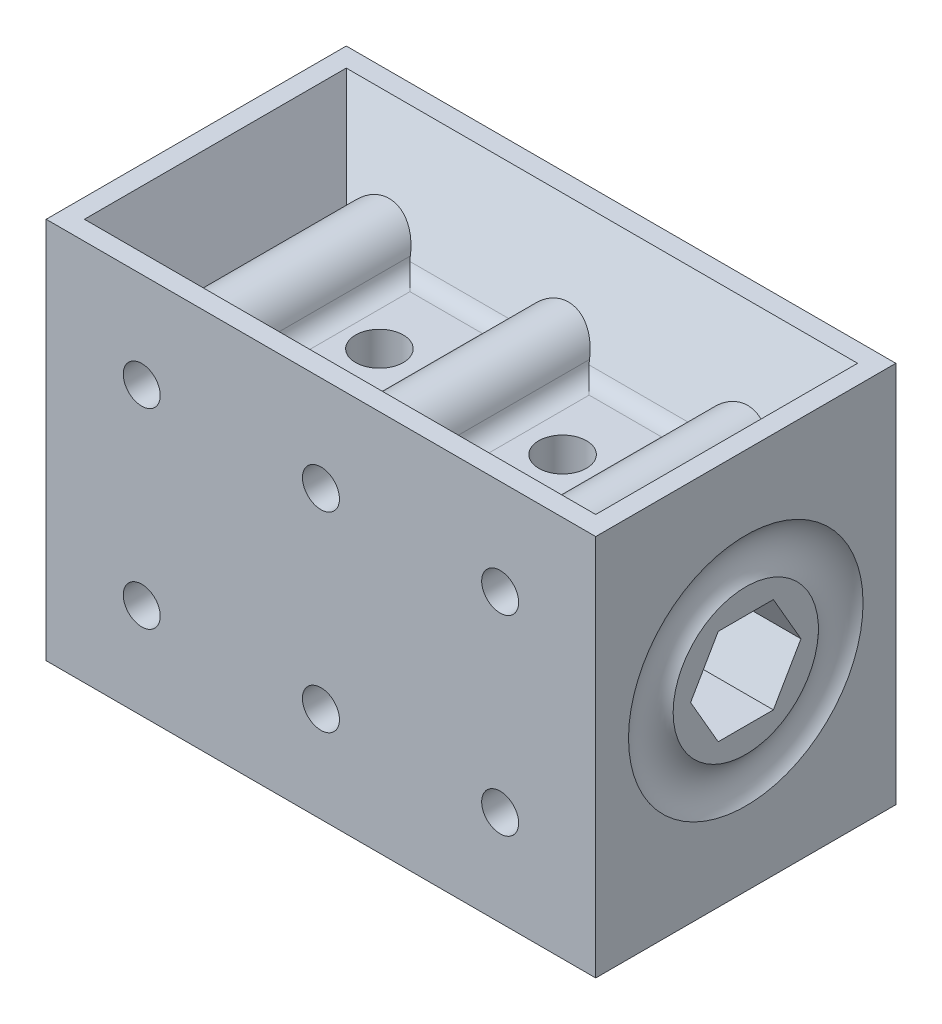
from build123d import *

# Parameters (mm, degrees)
SKETCH1_W                    = 39.878
SKETCH1_H                    = 50.8
BOSS_EXTRUDE1_DEPTH          = 73.025
CUT_EXTRUDE2_DEPTH           = 80.845941325
SKETCH9_R                    = 3.175
CUT_EXTRUDE4_DEPTH           = 93.511894506
F_10_0_1935_DIAMETER_HOLE1_D = 4.9149
SKETCH11_W                   = 67.945
SKETCH11_H                   = 34.798
CUT_EXTRUDE5_DEPTH           = 12.7
CUT_EXTRUDE5_DRAFT           = -30
EXTRUDE_THIN1_REACH          = 88.995
SKETCH12_R                   = 4.99745
SKETCH12_R_2                 = 2.45745
FILLET1_R                    = 2.54


with BuildPart() as part:
    # Sketch1 → Boss-Extrude1 (new body)
    with BuildSketch(Plane(origin=(0, 0, 0), x_dir=(0, 0, -1), z_dir=(1, 0, 0))):
        Rectangle(SKETCH1_W, SKETCH1_H)
    extrude(amount=BOSS_EXTRUDE1_DEPTH)

    # Sketch3 → Cut-Extrude2 (cut, through all)
    with BuildSketch(Plane(origin=(73.025, 0, 0), x_dir=(0, 0, -1), z_dir=(1, 0, 0))):
        Polygon((3.666174209, 6.35), (-3.666174209, 6.35), (-7.332348419, 0), (-3.666174209, -6.35), (3.666174209, -6.35), (7.332348419, 0), align=None)
    extrude(amount=-CUT_EXTRUDE2_DEPTH, mode=Mode.SUBTRACT)

    # Sketch9 → Cut-Extrude4 (cut, through all)
    with BuildSketch(Plane(origin=(0, -25.4, -5.461), x_dir=(1, 0, 0), z_dir=(0, -1, 0))):
        with Locations(Location((24.341666667, 5.461, 0), (0, 0, 270))):
            Circle(SKETCH9_R)
        with Locations(Location((48.683333333, 5.461, 0), (0, 0, 270))):
            Circle(SKETCH9_R)
    extrude(amount=-CUT_EXTRUDE4_DEPTH, mode=Mode.SUBTRACT)

    # Cut-Sweep1: read off the stored shape, not the designer's step
    # Cut-Sweep1: loft between two sections, ruled curve by curve
    cut_sweep1_from = [
        Edge.make_bspline([(55.27802, -26.400000018, -15.134755726), (55.27802, -26.068077614, -15.152151062), (55.27802, -25.721960027, -15.176501267), (55.27802, -24.64806692, -15.17649704), (55.27802, -23.870873724, -15.030393808), (55.27802, -22.4137214, -14.433157355), (55.27802, -21.735879568, -13.982340569), (55.27802, -20.614131775, -12.852286443), (55.27802, -20.171469343, -12.174615377), (55.27802, -19.587882304, -10.728912945), (55.27802, -19.446875, -9.962776979), (55.27802, -19.446875, -9.223375)], [0, 0, 0, 0, 0.025567224, 0.025567224, 0.085279113, 0.085279113, 0.144991002, 0.144991002, 0.204702891, 0.204702891, 0.26441478, 0.26441478, 0.26441478, 0.26441478], 3),
        Edge.make_bspline([(55.27802, -26.566166679, -18.305404499), (55.27802, -26.263424965, -18.321270533), (55.27802, -25.889992145, -18.351502595), (55.27802, -24.25563029, -18.35149394), (55.27802, -23.064282925, -18.131136083), (55.27802, -20.812096264, -17.208042367), (55.27802, -19.788522216, -16.527346364), (55.27802, -18.054828511, -14.780815054), (55.27802, -17.386278491, -13.756930731), (55.27802, -16.484727368, -11.523546029), (55.27802, -16.271875, -10.365661382), (55.27802, -16.271875, -9.223375)], [0, 0, 0, 0, 0.025567224, 0.025567224, 0.085279113, 0.085279113, 0.144991002, 0.144991002, 0.204702891, 0.204702891, 0.26441478, 0.26441478, 0.26441478, 0.26441478], 3),
        Edge.make_bspline([(55.27802, -19.446875, 9.223375), (55.27802, -19.446875, 10.047786232), (55.27802, -19.625421872, 10.929168038), (55.27802, -20.391245406, 12.56520759), (55.27802, -20.978631569, 13.312168073), (55.27802, -22.401025327, 14.445720272), (55.27802, -23.228644676, 14.829824625), (55.27802, -24.457253142, 15.116402991), (55.27802, -24.864786623, 15.165468066), (55.27802, -25.652551734, 15.184176181), (55.27802, -26.022709672, 15.154528702), (55.27802, -26.400000018, 15.134755726)], [0.735583655, 0.735583655, 0.735583655, 0.735583655, 0.801687741, 0.801687741, 0.867791828, 0.867791828, 0.933895914, 0.933895914, 0.966947957, 0.966947957, 1, 1, 1, 1], 3),
        Edge.make_bspline([(55.27802, -16.271875, 9.223375), (55.27802, -16.271875, 10.504944594), (55.27802, -16.537624991, 11.821787882), (55.27802, -17.727931502, 14.364654747), (55.27802, -18.605376264, 15.480750251), (55.27802, -20.816764309, 17.243078545), (55.27802, -22.059883722, 17.817433387), (55.27802, -23.959807208, 18.260600105), (55.27802, -24.580520299, 18.334612193), (55.27802, -25.786065181, 18.36324232), (55.27802, -26.248443063, 18.322055703), (55.27802, -26.566166679, 18.305404499)], [0.735583655, 0.735583655, 0.735583655, 0.735583655, 0.801687741, 0.801687741, 0.867791828, 0.867791828, 0.933895914, 0.933895914, 0.966947957, 0.966947957, 1, 1, 1, 1], 3),
        Edge.make_line((55.27802, -19.446875, -9.223375), (55.27802, -19.446875, 9.223375)),
        Edge.make_line((55.27802, -16.271875, 9.223375), (55.27802, -16.271875, -9.223375)),
        Edge.make_line((55.27802, -26.566166679, -18.305404499), (55.27802, -26.400000018, -15.134755726)),
        Edge.make_line((55.27802, -26.566166679, 18.305404499), (55.27802, -26.400000018, 15.134755726)),
    ]
    cut_sweep1_to = [
        Edge.make_bspline([(61.62802, -26.400000018, -15.134755726), (61.62802, -26.068077614, -15.152151062), (61.62802, -25.721960027, -15.176501267), (61.62802, -24.64806692, -15.17649704), (61.62802, -23.870873724, -15.030393808), (61.62802, -22.4137214, -14.433157355), (61.62802, -21.735879568, -13.982340569), (61.62802, -20.614131775, -12.852286443), (61.62802, -20.171469343, -12.174615377), (61.62802, -19.587882304, -10.728912945), (61.62802, -19.446875, -9.962776979), (61.62802, -19.446875, -9.223375)], [0, 0, 0, 0, 0.025567224, 0.025567224, 0.085279113, 0.085279113, 0.144991002, 0.144991002, 0.204702891, 0.204702891, 0.26441478, 0.26441478, 0.26441478, 0.26441478], 3),
        Edge.make_bspline([(61.62802, -26.566166679, -18.305404499), (61.62802, -26.263424965, -18.321270533), (61.62802, -25.889992145, -18.351502595), (61.62802, -24.25563029, -18.35149394), (61.62802, -23.064282925, -18.131136083), (61.62802, -20.812096264, -17.208042367), (61.62802, -19.788522216, -16.527346364), (61.62802, -18.054828511, -14.780815054), (61.62802, -17.386278491, -13.756930731), (61.62802, -16.484727368, -11.523546029), (61.62802, -16.271875, -10.365661382), (61.62802, -16.271875, -9.223375)], [0, 0, 0, 0, 0.025567224, 0.025567224, 0.085279113, 0.085279113, 0.144991002, 0.144991002, 0.204702891, 0.204702891, 0.26441478, 0.26441478, 0.26441478, 0.26441478], 3),
        Edge.make_bspline([(61.62802, -19.446875, 9.223375), (61.62802, -19.446875, 10.047786232), (61.62802, -19.625421872, 10.929168038), (61.62802, -20.391245406, 12.56520759), (61.62802, -20.978631569, 13.312168073), (61.62802, -22.401025327, 14.445720272), (61.62802, -23.228644676, 14.829824625), (61.62802, -24.457253142, 15.116402991), (61.62802, -24.864786623, 15.165468066), (61.62802, -25.652551734, 15.184176181), (61.62802, -26.022709672, 15.154528702), (61.62802, -26.400000018, 15.134755726)], [0.735583655, 0.735583655, 0.735583655, 0.735583655, 0.801687741, 0.801687741, 0.867791828, 0.867791828, 0.933895914, 0.933895914, 0.966947957, 0.966947957, 1, 1, 1, 1], 3),
        Edge.make_bspline([(61.62802, -16.271875, 9.223375), (61.62802, -16.271875, 10.504944594), (61.62802, -16.537624991, 11.821787882), (61.62802, -17.727931502, 14.364654747), (61.62802, -18.605376264, 15.480750251), (61.62802, -20.816764309, 17.243078545), (61.62802, -22.059883722, 17.817433387), (61.62802, -23.959807208, 18.260600105), (61.62802, -24.580520299, 18.334612193), (61.62802, -25.786065181, 18.36324232), (61.62802, -26.248443063, 18.322055703), (61.62802, -26.566166679, 18.305404499)], [0.735583655, 0.735583655, 0.735583655, 0.735583655, 0.801687741, 0.801687741, 0.867791828, 0.867791828, 0.933895914, 0.933895914, 0.966947957, 0.966947957, 1, 1, 1, 1], 3),
        Edge.make_line((61.62802, -19.446875, -9.223375), (61.62802, -19.446875, 9.223375)),
        Edge.make_line((61.62802, -16.271875, 9.223375), (61.62802, -16.271875, -9.223375)),
        Edge.make_line((61.62802, -26.566166679, -18.305404499), (61.62802, -26.400000018, -15.134755726)),
        Edge.make_line((61.62802, -26.566166679, 18.305404499), (61.62802, -26.400000018, 15.134755726)),
    ]
    cut_sweep1 = Solid(Shell([*[Face.make_surface_from_curves(cut_sweep1_from[k], cut_sweep1_to[k]) for k in range(8)], Face(Wire(cut_sweep1_from)), Face(Wire(cut_sweep1_to))]))
    add(cut_sweep1, mode=Mode.SUBTRACT)

    # Cut-Sweep1 2: loft between two sections, ruled curve by curve
    cut_sweep1_2_from = [
        Edge.make_bspline([(11.39698, -26.400000017, -15.134755726), (11.39698, -26.068077614, -15.152151062), (11.39698, -25.721960027, -15.176501267), (11.39698, -24.64806692, -15.17649704), (11.39698, -23.870873724, -15.030393808), (11.39698, -22.4137214, -14.433157355), (11.39698, -21.735879568, -13.982340569), (11.39698, -20.614131775, -12.852286443), (11.39698, -20.171469343, -12.174615377), (11.39698, -19.587882304, -10.728912945), (11.39698, -19.446875, -9.962776978), (11.39698, -19.446875, -9.223375)], [0, 0, 0, 0, 0.025567224, 0.025567224, 0.085279113, 0.085279113, 0.144991002, 0.144991002, 0.204702891, 0.204702891, 0.26441478, 0.26441478, 0.26441478, 0.26441478], 3),
        Edge.make_bspline([(11.39698, -26.566166679, -18.305404499), (11.39698, -26.263424965, -18.321270533), (11.39698, -25.889992145, -18.351502595), (11.39698, -24.25563029, -18.35149394), (11.39698, -23.064282925, -18.131136083), (11.39698, -20.812096264, -17.208042367), (11.39698, -19.788522216, -16.527346364), (11.39698, -18.054828511, -14.780815053), (11.39698, -17.386278491, -13.756930731), (11.39698, -16.484727368, -11.523546028), (11.39698, -16.271875, -10.365661382), (11.39698, -16.271875, -9.223375)], [0, 0, 0, 0, 0.025567224, 0.025567224, 0.085279113, 0.085279113, 0.144991002, 0.144991002, 0.204702891, 0.204702891, 0.26441478, 0.26441478, 0.26441478, 0.26441478], 3),
        Edge.make_bspline([(11.39698, -19.446875, 9.223375), (11.39698, -19.446875, 10.047786232), (11.39698, -19.625421872, 10.929168038), (11.39698, -20.391245407, 12.565207589), (11.39698, -20.97863157, 13.312168073), (11.39698, -22.401025327, 14.445720271), (11.39698, -23.228644676, 14.829824624), (11.39698, -24.457253143, 15.11640299), (11.39698, -24.864786623, 15.165468065), (11.39698, -25.652551734, 15.18417618), (11.39698, -26.022709672, 15.154528701), (11.39698, -26.400000017, 15.134755725)], [0.735583655, 0.735583655, 0.735583655, 0.735583655, 0.801687741, 0.801687741, 0.867791828, 0.867791828, 0.933895914, 0.933895914, 0.966947957, 0.966947957, 1, 1, 1, 1], 3),
        Edge.make_bspline([(11.39698, -16.271875, 9.223375), (11.39698, -16.271875, 10.504944594), (11.39698, -16.537624992, 11.821787882), (11.39698, -17.727931503, 14.364654747), (11.39698, -18.605376265, 15.480750251), (11.39698, -20.81676431, 17.243078544), (11.39698, -22.059883722, 17.817433386), (11.39698, -23.959807209, 18.260600104), (11.39698, -24.5805203, 18.334612192), (11.39698, -25.786065181, 18.363242319), (11.39698, -26.248443063, 18.322055702), (11.39698, -26.566166679, 18.305404498)], [0.735583655, 0.735583655, 0.735583655, 0.735583655, 0.801687741, 0.801687741, 0.867791828, 0.867791828, 0.933895914, 0.933895914, 0.966947957, 0.966947957, 1, 1, 1, 1], 3),
        Edge.make_line((11.39698, -19.446875, -9.223375), (11.39698, -19.446875, 9.223375)),
        Edge.make_line((11.39698, -16.271875, 9.223375), (11.39698, -16.271875, -9.223375)),
        Edge.make_line((11.39698, -26.566166679, -18.305404499), (11.39698, -26.400000017, -15.134755726)),
        Edge.make_line((11.39698, -26.566166679, 18.305404498), (11.39698, -26.400000017, 15.134755725)),
    ]
    cut_sweep1_2_to = [
        Edge.make_bspline([(17.74698, -26.400000017, -15.134755726), (17.74698, -26.068077614, -15.152151062), (17.74698, -25.721960027, -15.176501267), (17.74698, -24.64806692, -15.17649704), (17.74698, -23.870873724, -15.030393808), (17.74698, -22.4137214, -14.433157355), (17.74698, -21.735879568, -13.982340569), (17.74698, -20.614131775, -12.852286443), (17.74698, -20.171469343, -12.174615377), (17.74698, -19.587882304, -10.728912945), (17.74698, -19.446875, -9.962776978), (17.74698, -19.446875, -9.223375)], [0, 0, 0, 0, 0.025567224, 0.025567224, 0.085279113, 0.085279113, 0.144991002, 0.144991002, 0.204702891, 0.204702891, 0.26441478, 0.26441478, 0.26441478, 0.26441478], 3),
        Edge.make_bspline([(17.74698, -26.566166679, -18.305404499), (17.74698, -26.263424965, -18.321270533), (17.74698, -25.889992145, -18.351502595), (17.74698, -24.25563029, -18.35149394), (17.74698, -23.064282925, -18.131136083), (17.74698, -20.812096264, -17.208042367), (17.74698, -19.788522216, -16.527346364), (17.74698, -18.054828511, -14.780815053), (17.74698, -17.386278491, -13.756930731), (17.74698, -16.484727368, -11.523546028), (17.74698, -16.271875, -10.365661382), (17.74698, -16.271875, -9.223375)], [0, 0, 0, 0, 0.025567224, 0.025567224, 0.085279113, 0.085279113, 0.144991002, 0.144991002, 0.204702891, 0.204702891, 0.26441478, 0.26441478, 0.26441478, 0.26441478], 3),
        Edge.make_bspline([(17.74698, -19.446875, 9.223375), (17.74698, -19.446875, 10.047786232), (17.74698, -19.625421872, 10.929168038), (17.74698, -20.391245407, 12.565207589), (17.74698, -20.97863157, 13.312168073), (17.74698, -22.401025327, 14.445720271), (17.74698, -23.228644676, 14.829824624), (17.74698, -24.457253142, 15.11640299), (17.74698, -24.864786623, 15.165468065), (17.74698, -25.652551734, 15.18417618), (17.74698, -26.022709672, 15.154528701), (17.74698, -26.400000018, 15.134755725)], [0.735583655, 0.735583655, 0.735583655, 0.735583655, 0.801687741, 0.801687741, 0.867791828, 0.867791828, 0.933895914, 0.933895914, 0.966947957, 0.966947957, 1, 1, 1, 1], 3),
        Edge.make_bspline([(17.74698, -16.271875, 9.223375), (17.74698, -16.271875, 10.504944594), (17.74698, -16.537624992, 11.821787882), (17.74698, -17.727931503, 14.364654747), (17.74698, -18.605376265, 15.480750251), (17.74698, -20.81676431, 17.243078544), (17.74698, -22.059883722, 17.817433386), (17.74698, -23.959807209, 18.260600104), (17.74698, -24.5805203, 18.334612192), (17.74698, -25.786065181, 18.363242319), (17.74698, -26.248443063, 18.322055702), (17.74698, -26.566166679, 18.305404498)], [0.735583655, 0.735583655, 0.735583655, 0.735583655, 0.801687741, 0.801687741, 0.867791828, 0.867791828, 0.933895914, 0.933895914, 0.966947957, 0.966947957, 1, 1, 1, 1], 3),
        Edge.make_line((17.74698, -19.446875, -9.223375), (17.74698, -19.446875, 9.223375)),
        Edge.make_line((17.74698, -16.271875, 9.223375), (17.74698, -16.271875, -9.223375)),
        Edge.make_line((17.74698, -26.566166679, -18.305404499), (17.74698, -26.400000017, -15.134755726)),
        Edge.make_line((17.74698, -26.566166679, 18.305404498), (17.74698, -26.400000018, 15.134755725)),
    ]
    cut_sweep1_2 = Solid(Shell([*[Face.make_surface_from_curves(cut_sweep1_2_from[k], cut_sweep1_2_to[k]) for k in range(8)], Face(Wire(cut_sweep1_2_from)), Face(Wire(cut_sweep1_2_to))]))
    add(cut_sweep1_2, mode=Mode.SUBTRACT)

    # #10 (0.1935) Diameter Hole1 (through all)
    with Locations(Plane.XY.offset(19.939)):
        with Locations((12.7, 12.7), (36.5125, 12.7), (60.325, 12.7), (60.325, -12.7), (36.5125, -12.7), (12.7, -12.7)):
            Hole(F_10_0_1935_DIAMETER_HOLE1_D / 2)


with BuildPart() as cut_extrude5_tool:
    # Sketch11 → Cut-Extrude5 (with draft: the straight prism first)
    with BuildSketch(Plane(origin=(0, 25.4, 0), x_dir=(1, 0, 0), z_dir=(0, 1, 0))):
        with Locations((36.5125, 0)):
            Rectangle(SKETCH11_W, SKETCH11_H)
    extrude(amount=-CUT_EXTRUDE5_DEPTH)
    # Cut-Extrude5: the draft: its side faces are tilted about the plane it starts from
    cut_extrude5_sides = [cut_extrude5_tool.faces().sort_by_distance(p)[0] for p in [
        (70.485, 19.05, 0),
        (36.5125, 19.05, -17.399),
        (2.54, 19.05, 0),
        (36.5125, 19.05, 17.399),
    ]]
    draft(cut_extrude5_sides, Plane(origin=(0, 25.4, 0), x_dir=(1, 0, 0), z_dir=(0, 1, 0)), CUT_EXTRUDE5_DRAFT)


with BuildPart() as part_1:
    add(part.part)

    # Cut-Extrude5: cut by cut_extrude5_tool
    add(cut_extrude5_tool.part, mode=Mode.SUBTRACT)

    # Sketch12 → Extrude-Thin1 (add, up to next)
    with BuildSketch(Plane(origin=(0, 0, -19.939), x_dir=(-1, 0, 0), z_dir=(0, 0, -1)), mode=Mode.PRIVATE) as extrude_thin1_sk1:
        with Locations((-12.7, 12.7)):
            Circle(SKETCH12_R)
        with Locations((-12.7, 12.7)):
            Circle(SKETCH12_R_2, mode=Mode.SUBTRACT)
    extrude_thin1_tool1 = extrude(extrude_thin1_sk1.sketch, amount=-EXTRUDE_THIN1_REACH, mode=Mode.PRIVATE) - part_1.part
    # Sketch12 → Extrude-Thin1 (add, up to next)
    with BuildSketch(Plane(origin=(0, 0, -19.939), x_dir=(-1, 0, 0), z_dir=(0, 0, -1)), mode=Mode.PRIVATE) as extrude_thin1_sk2:
        with Locations((-36.5125, 12.7)):
            Circle(SKETCH12_R)
        with Locations((-36.5125, 12.7)):
            Circle(SKETCH12_R_2, mode=Mode.SUBTRACT)
    extrude_thin1_tool2 = extrude(extrude_thin1_sk2.sketch, amount=-EXTRUDE_THIN1_REACH, mode=Mode.PRIVATE) - part_1.part
    # Sketch12 → Extrude-Thin1 (add, up to next)
    with BuildSketch(Plane(origin=(0, 0, -19.939), x_dir=(-1, 0, 0), z_dir=(0, 0, -1)), mode=Mode.PRIVATE) as extrude_thin1_sk3:
        with Locations((-60.325, 12.7)):
            Circle(SKETCH12_R)
        with Locations((-60.325, 12.7)):
            Circle(SKETCH12_R_2, mode=Mode.SUBTRACT)
    extrude_thin1_tool3 = extrude(extrude_thin1_sk3.sketch, amount=-EXTRUDE_THIN1_REACH, mode=Mode.PRIVATE) - part_1.part
    add(extrude_thin1_tool1.solids().sort_by_distance((17.556101, 12.7, -19.939))[0])
    add(extrude_thin1_tool2.solids().sort_by_distance((41.368601, 12.7, -19.939))[0])
    add(extrude_thin1_tool3.solids().sort_by_distance((65.181101, 12.7, -19.939))[0])

    # Fillet1
    fillet1_edges = [part_1.edges().sort_by_distance(p)[0] for p in [
        (48.41875, 12.7, -10.066651581),
        (24.60625, 12.7, -10.066651581),
        (24.60625, 12.7, 10.066651581),
        (48.41875, 12.7, 10.066651581),
        (17.69745, 12.7, 0),
        (41.50995, 12.7, 0),
        (31.51505, 12.7, 0),
        (55.32755, 12.7, 0),
    ]]
    fillet(fillet1_edges, radius=FILLET1_R)

    # Sketch13 → Cut-Revolve1 (revolve, cut)
    with BuildSketch(Plane.XY, mode=Mode.PRIVATE) as cut_revolve1_sk:
        with BuildLine():
            Line((0, 15.5829), (0, 9.652))
            ThreePointArc((0, 9.652), (1.228329609, 12.61745), (0, 15.5829))
        make_face()
    cut_revolve1 = revolve(cut_revolve1_sk.sketch.rotate(Axis((-80.9, 0, 0), (1, 0, 0)), 90), axis=Axis((-80.9, 0, 0), (1, 0, 0)), mode=Mode.SUBTRACT)

    # Mirror1: Cut-Revolve1 across plane
    add(cut_revolve1.mirror(Plane.ZY.offset(-36.5125)), mode=Mode.SUBTRACT)


solid = part_1.part
